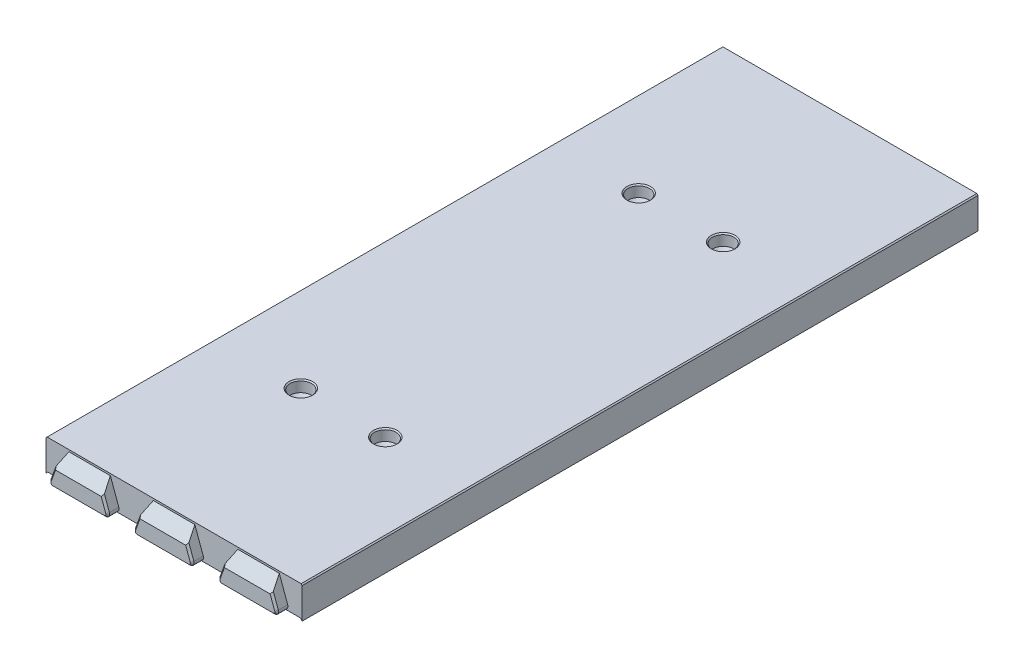
from build123d import *

# Parameters (mm, degrees)
BOSS_EXTRUDE1_DEPTH             = 90
SKETCH7_W                       = 64.25
SKETCH7_H                       = 6
BOSS_EXTRUDE7_DEPTH             = 1
BOSS_EXTRUDE4_DEPTH             = 3
BOSS_EXTRUDE8_REACH             = 98.584
BOSS_EXTRUDE8_DIRECTION_2_DEPTH = 2
CHAMFER4_SIZE                   = 0.5
FILLET4_R                       = 1
CHAMFER6_SIZE                   = 0.5
FILLET2_R                       = 2
CHAMFER4_OF_MIRROR2_SIZE        = 0.5
FILLET4_OF_MIRROR2_R            = 1
CHAMFER6_OF_MIRROR2_SIZE        = 0.5
FILLET2_OF_MIRROR2_R            = 2
BOSS_EXTRUDE9_REACH             = 188.326
SKETCH9_R                       = 5
FILLET3_R                       = 3
SKETCH10_R                      = 1.85
CUT_EXTRUDE2_DEPTH              = 187.326368571
SKETCH11_R                      = 2.85
CUT_EXTRUDE3_DEPTH              = 3
CHAMFER7_SIZE                   = 1
CUT_EXTRUDE4_DEPTH              = 187.326368571
CUT_EXTRUDE4_DEPTH_BACK         = 187.326368571
BOSS_EXTRUDE10_DEPTH            = 180
CHAMFER8_SIZE                   = 0.3


with BuildPart() as part:
    # Sketch1 → Boss-Extrude1 (new body)
    with BuildSketch(Plane.XY):
        Polygon((-34.125, 0), (-34.125, 8), (34.125, 8), (34.125, 0), (32.125, 0), (32.125, 6), (-32.125, 6), (-32.125, 0), align=None)
    boss_extrude1 = extrude(amount=-BOSS_EXTRUDE1_DEPTH)

    # Sketch7 → Boss-Extrude7 (add)
    with BuildSketch(Plane.XY):
        with Locations((0, 3)):
            Rectangle(SKETCH7_W, SKETCH7_H)
    boss_extrude7 = extrude(amount=-BOSS_EXTRUDE7_DEPTH)

    # Sketch2 → Boss-Extrude4 (add)
    with BuildSketch(Plane.XY):
        Polygon((17.161761874, 8), (14.25, 0), (30.75, 0), (27.838238126, 8), align=None)
        Polygon((-5.338238126, 8), (-8.25, 0), (8.25, 0), (5.338238126, 8), align=None)
        Polygon((-27.838238126, 8), (-30.75, 0), (-14.25, 0), (-17.161761874, 8), align=None)
    boss_extrude4 = extrude(amount=BOSS_EXTRUDE4_DEPTH)

    # Sketch8 → Boss-Extrude8 (add, up to next)
    with BuildSketch(Plane.XZ, mode=Mode.PRIVATE) as boss_extrude8_sk1:
        Polygon((-32.6, -24.741658736), (-32.6, -20.258341264), (-28.9, -21.605031131), (-28.9, -23.394968869), align=None)
    boss_extrude8_tool1 = extrude(boss_extrude8_sk1.sketch, amount=-BOSS_EXTRUDE8_REACH, mode=Mode.PRIVATE) - part.part
    # Sketch8 → Boss-Extrude8 (add, up to next)
    with BuildSketch(Plane.XZ, mode=Mode.PRIVATE) as boss_extrude8_sk2:
        Polygon((-32.6, -89.85), (-32.6, -87.758341264), (-28.9, -89.105031131), (-28.9, -89.85), (-28.9, -90), (-32.6, -90), align=None)
    boss_extrude8_tool2 = extrude(boss_extrude8_sk2.sketch, amount=-BOSS_EXTRUDE8_REACH, mode=Mode.PRIVATE) - part.part
    # Sketch8 → Boss-Extrude8 (add, up to next)
    with BuildSketch(Plane.XZ, mode=Mode.PRIVATE) as boss_extrude8_sk3:
        Polygon((32.6, -24.741658736), (28.9, -23.394968869), (28.9, -21.605031131), (32.6, -20.258341264), align=None)
    boss_extrude8_tool3 = extrude(boss_extrude8_sk3.sketch, amount=-BOSS_EXTRUDE8_REACH, mode=Mode.PRIVATE) - part.part
    # Sketch8 → Boss-Extrude8 (add, up to next)
    with BuildSketch(Plane.XZ, mode=Mode.PRIVATE) as boss_extrude8_sk4:
        Polygon((32.6, -89.85), (32.6, -90), (28.9, -90), (28.9, -89.85), (28.9, -89.105031131), (32.6, -87.758341264), align=None)
    boss_extrude8_tool4 = extrude(boss_extrude8_sk4.sketch, amount=-BOSS_EXTRUDE8_REACH, mode=Mode.PRIVATE) - part.part
    boss_extrude8_1 = boss_extrude8_tool1.solids().sort_by_distance((-31.014762, 0, -22.5))[0]
    add(boss_extrude8_1)
    boss_extrude8_2 = boss_extrude8_tool2.solids().sort_by_distance((-31.014762, 0, -89.16766))[0]
    add(boss_extrude8_2)
    boss_extrude8_3 = boss_extrude8_tool3.solids().sort_by_distance((31.014762, 0, -22.5))[0]
    add(boss_extrude8_3)
    boss_extrude8_4 = boss_extrude8_tool4.solids().sort_by_distance((31.014762, 0, -89.16766))[0]
    add(boss_extrude8_4)
    boss_extrude8 = boss_extrude8_1 + boss_extrude8_2 + boss_extrude8_3 + boss_extrude8_4  # Boss-Extrude8 as one shape, for the pattern or mirror that repeats it

    # Sketch8 → Boss-Extrude8 direction 2 (add)
    with BuildSketch(Plane.XZ):
        Polygon((-32.6, -24.741658736), (-32.6, -20.258341264), (-28.9, -21.605031131), (-28.9, -23.394968869), align=None)
        Polygon((-32.6, -89.85), (-32.6, -87.758341264), (-28.9, -89.105031131), (-28.9, -89.85), (-28.9, -90), (-32.6, -90), align=None)
        Polygon((32.6, -24.741658736), (28.9, -23.394968869), (28.9, -21.605031131), (32.6, -20.258341264), align=None)
        Polygon((32.6, -89.85), (32.6, -90), (28.9, -90), (28.9, -89.85), (28.9, -89.105031131), (32.6, -87.758341264), align=None)
    boss_extrude8_direction_2 = extrude(amount=BOSS_EXTRUDE8_DIRECTION_2_DEPTH)

    # Chamfer4
    chamfer4_edges = [part.edges().sort_by_distance(p)[0] for p in [
        (-32.6, -2, -88.879170632),
        (-28.9, -2, -89.552515565),
        (-30.75, -2, -88.431686197),
        (30.75, -2, -88.431686197),
        (28.9, -2, -89.552515565),
        (32.6, -2, -88.879170632),
        (32.6, -2, -22.5),
        (30.75, -2, -20.931686197),
        (28.9, -2, -22.5),
        (30.75, -2, -24.068313803),
        (-30.75, -2, -24.068313803),
        (-28.9, -2, -22.5),
        (-30.75, -2, -20.931686197),
        (-32.6, -2, -22.5),
    ]]
    chamfer(chamfer4_edges, length=CHAMFER4_SIZE)

    # Fillet4
    fillet4_edges = [part.edges().sort_by_distance(p)[0] for p in [
        (14.25, 0, 1.5),
        (30.75, 0, 1.5),
        (-8.25, 0, 1.5),
        (8.25, 0, 1.5),
        (-30.75, 0, 1.5),
        (-14.25, 0, 1.5),
    ]]
    fillet(fillet4_edges, radius=FILLET4_R)

    # Chamfer6
    chamfer6_edges = [part.edges().sort_by_distance(p)[0] for p in [
        (29.04989137, 4.671010072, 3),
        (22.5, 0, 3),
        (0, 0, 3),
        (-22.5, 0, 3),
        (14.858995962, 0.426423564, 3),
        (30.141004038, 0.426423564, 3),
        (6.54989137, 4.671010072, 3),
        (-7.641004038, 0.426423564, 3),
        (7.641004038, 0.426423564, 3),
        (-15.95010863, 4.671010072, 3),
        (-30.141004038, 0.426423564, 3),
        (-14.858995962, 0.426423564, 3),
        (15.95010863, 4.671010072, 3),
        (-6.54989137, 4.671010072, 3),
        (-29.04989137, 4.671010072, 3),
    ]]
    chamfer(chamfer6_edges, length=CHAMFER6_SIZE)

    # Fillet2
    fillet2_edges = [part.edges().sort_by_distance(p)[0] for p in [
        (-32.125, 6, -56.25),
        (-32.125, 3, -87.931227125),
        (-28.9, 6, -89.552515565),
        (-30.5125, 6, -88.518129128),
        (32.125, 6, -56.25),
        (32.125, 3, -87.931227125),
        (30.5125, 6, -88.518129128),
        (28.9, 6, -89.552515565),
        (32.125, 6, -10.715613563),
        (32.125, 3, -20.431227125),
        (32.125, 3, -24.568772875),
        (30.5125, 6, -21.018129128),
        (30.5125, 6, -23.981870872),
        (28.9, 6, -22.5),
        (-32.125, 3, -1),
        (0, 6, -1),
        (32.125, 3, -1),
        (-32.125, 6, -10.715613563),
        (-32.125, 3, -24.568772875),
        (-32.125, 3, -20.431227125),
        (-30.5125, 6, -23.981870872),
        (-30.5125, 6, -21.018129128),
        (-28.9, 6, -22.5),
    ]]
    fillet(fillet2_edges, radius=FILLET2_R)


with BuildPart() as mirror2_1:
    # Mirror2: Boss-Extrude1, Boss-Extrude7, Boss-Extrude4, Boss-Extrude8, Boss-Extrude8 direction 2 across plane
    add(boss_extrude1.mirror(Plane.XY.offset(-90)))
    add(boss_extrude7.mirror(Plane.XY.offset(-90)))
    add(boss_extrude4.mirror(Plane.XY.offset(-90)))
    add(boss_extrude8.mirror(Plane.XY.offset(-90)))
    add(boss_extrude8_direction_2.mirror(Plane.XY.offset(-90)))

    # Chamfer4 of Mirror2
    chamfer4_of_mirror2_edges = [mirror2_1.edges().sort_by_distance(p)[0] for p in [
        (-32.6, -2, -91.120829368),
        (-28.9, -2, -90.447484435),
        (-30.75, -2, -91.568313803),
        (30.75, -2, -91.568313803),
        (28.9, -2, -90.447484435),
        (32.6, -2, -91.120829368),
        (32.6, -2, -157.5),
        (30.75, -2, -159.068313803),
        (28.9, -2, -157.5),
        (30.75, -2, -155.931686197),
        (-30.75, -2, -155.931686197),
        (-28.9, -2, -157.5),
        (-30.75, -2, -159.068313803),
        (-32.6, -2, -157.5),
    ]]
    chamfer(chamfer4_of_mirror2_edges, length=CHAMFER4_OF_MIRROR2_SIZE)

    # Fillet4 of Mirror2
    fillet4_of_mirror2_edges = [mirror2_1.edges().sort_by_distance(p)[0] for p in [
        (14.25, 0, -181.5),
        (30.75, 0, -181.5),
        (-8.25, 0, -181.5),
        (8.25, 0, -181.5),
        (-30.75, 0, -181.5),
        (-14.25, 0, -181.5),
    ]]
    fillet(fillet4_of_mirror2_edges, radius=FILLET4_OF_MIRROR2_R)

    # Chamfer6 of Mirror2
    chamfer6_of_mirror2_edges = [mirror2_1.edges().sort_by_distance(p)[0] for p in [
        (29.04989137, 4.671010072, -183),
        (22.5, 0, -183),
        (0, 0, -183),
        (-22.5, 0, -183),
        (14.858995962, 0.426423564, -183),
        (30.141004038, 0.426423564, -183),
        (6.54989137, 4.671010072, -183),
        (-7.641004038, 0.426423564, -183),
        (7.641004038, 0.426423564, -183),
        (-15.95010863, 4.671010072, -183),
        (-30.141004038, 0.426423564, -183),
        (-14.858995962, 0.426423564, -183),
        (15.95010863, 4.671010072, -183),
        (-6.54989137, 4.671010072, -183),
        (-29.04989137, 4.671010072, -183),
    ]]
    chamfer(chamfer6_of_mirror2_edges, length=CHAMFER6_OF_MIRROR2_SIZE)

    # Fillet2 of Mirror2
    fillet2_of_mirror2_edges = [mirror2_1.edges().sort_by_distance(p)[0] for p in [
        (-32.125, 6, -123.75),
        (-32.125, 3, -92.068772875),
        (-28.9, 6, -90.447484435),
        (-30.5125, 6, -91.481870872),
        (32.125, 6, -123.75),
        (32.125, 3, -92.068772875),
        (30.5125, 6, -91.481870872),
        (28.9, 6, -90.447484435),
        (32.125, 6, -169.284386437),
        (32.125, 3, -159.568772875),
        (32.125, 3, -155.431227125),
        (30.5125, 6, -158.981870872),
        (30.5125, 6, -156.018129128),
        (28.9, 6, -157.5),
        (-32.125, 3, -179),
        (0, 6, -179),
        (32.125, 3, -179),
        (-32.125, 6, -169.284386437),
        (-32.125, 3, -155.431227125),
        (-32.125, 3, -159.568772875),
        (-30.5125, 6, -156.018129128),
        (-30.5125, 6, -158.981870872),
        (-28.9, 6, -157.5),
    ]]
    fillet(fillet2_of_mirror2_edges, radius=FILLET2_OF_MIRROR2_R)


with BuildPart() as part_1:
    add(part.part)

    # Mirror2 united with what the copies touc: union Mirror2_1
    add(mirror2_1.part)

    # Sketch9 → Boss-Extrude9 (add, up to next)
    with BuildSketch(Plane(origin=(0, 0, 0), x_dir=(1, 0, 0), z_dir=(0, 1, 0)), mode=Mode.PRIVATE) as boss_extrude9_sk1:
        with Locations(Location((-11.25, 45, 0), (0, 0, 90))):
            Circle(SKETCH9_R)
    boss_extrude9_tool1 = extrude(boss_extrude9_sk1.sketch, amount=BOSS_EXTRUDE9_REACH, mode=Mode.PRIVATE) - part_1.part
    # Sketch9 → Boss-Extrude9 (add, up to next)
    with BuildSketch(Plane(origin=(0, 0, 0), x_dir=(1, 0, 0), z_dir=(0, 1, 0)), mode=Mode.PRIVATE) as boss_extrude9_sk2:
        with Locations(Location((11.25, 45, 0), (0, 0, 90))):
            Circle(SKETCH9_R)
    boss_extrude9_tool2 = extrude(boss_extrude9_sk2.sketch, amount=BOSS_EXTRUDE9_REACH, mode=Mode.PRIVATE) - part_1.part
    # Sketch9 → Boss-Extrude9 (add, up to next)
    with BuildSketch(Plane(origin=(0, 0, 0), x_dir=(1, 0, 0), z_dir=(0, 1, 0)), mode=Mode.PRIVATE) as boss_extrude9_sk3:
        with Locations(Location((11.25, 135, 0), (0, 0, 90))):
            Circle(SKETCH9_R)
    boss_extrude9_tool3 = extrude(boss_extrude9_sk3.sketch, amount=BOSS_EXTRUDE9_REACH, mode=Mode.PRIVATE) - part_1.part
    # Sketch9 → Boss-Extrude9 (add, up to next)
    with BuildSketch(Plane(origin=(0, 0, 0), x_dir=(1, 0, 0), z_dir=(0, 1, 0)), mode=Mode.PRIVATE) as boss_extrude9_sk4:
        with Locations(Location((-11.25, 135, 0), (0, 0, 90))):
            Circle(SKETCH9_R)
    boss_extrude9_tool4 = extrude(boss_extrude9_sk4.sketch, amount=BOSS_EXTRUDE9_REACH, mode=Mode.PRIVATE) - part_1.part
    add(boss_extrude9_tool1.solids().sort_by_distance((-11.25, 0, -45))[0])
    add(boss_extrude9_tool2.solids().sort_by_distance((11.25, 0, -45))[0])
    add(boss_extrude9_tool3.solids().sort_by_distance((11.25, 0, -135))[0])
    add(boss_extrude9_tool4.solids().sort_by_distance((-11.25, 0, -135))[0])

    # Fillet3
    fillet3_edges = [part_1.edges().sort_by_distance(p)[0] for p in [
        (-11.25, 6, -40),
        (-11.25, 6, -130),
        (11.25, 6, -130),
        (11.25, 6, -40),
    ]]
    fillet(fillet3_edges, radius=FILLET3_R)

    # Sketch10 → Cut-Extrude2 (cut, through all)
    with BuildSketch(Plane(origin=(0, 0, 0), x_dir=(1, 0, 0), z_dir=(0, 1, 0))):
        with Locations(Location((-11.25, 45, 0), (0, 0, 270))):
            Circle(SKETCH10_R)
        with Locations(Location((11.25, 45, 0), (0, 0, 270))):
            Circle(SKETCH10_R)
        with Locations(Location((11.25, 135, 0), (0, 0, 270))):
            Circle(SKETCH10_R)
        with Locations(Location((-11.25, 135, 0), (0, 0, 270))):
            Circle(SKETCH10_R)
    extrude(amount=CUT_EXTRUDE2_DEPTH, mode=Mode.SUBTRACT)

    # Sketch11 → Cut-Extrude3 (cut)
    with BuildSketch(Plane(origin=(0, 8, 0), x_dir=(1, 0, 0), z_dir=(0, 1, 0))):
        with Locations(Location((-11.25, 135, 0), (0, 0, 270))):
            Circle(SKETCH11_R)
        with Locations(Location((11.25, 135, 0), (0, 0, 270))):
            Circle(SKETCH11_R)
        with Locations(Location((11.25, 45, 0), (0, 0, 270))):
            Circle(SKETCH11_R)
        with Locations(Location((-11.25, 45, 0), (0, 0, 270))):
            Circle(SKETCH11_R)
    extrude(amount=-CUT_EXTRUDE3_DEPTH, mode=Mode.SUBTRACT)

    # Chamfer7
    chamfer7_edges = [part_1.edges().sort_by_distance(p)[0] for p in [
        (-11.25, 5, -46.85),
        (11.25, 5, -46.85),
        (11.25, 5, -136.85),
        (-11.25, 5, -136.85),
    ]]
    chamfer(chamfer7_edges, length=CHAMFER7_SIZE - 0.0001)  # a hair under: the kernel refuses the full size

    # Sketch12 → Cut-Extrude4 (cut, two sides: drawn at the far end of the back side and taken through both)
    with BuildSketch(Plane(origin=(0, 0, 0), x_dir=(0, 0, -1), z_dir=(1, 0, 0)).offset(-CUT_EXTRUDE4_DEPTH_BACK)):
        Polygon((0, 7.5), (-3, 4.5), (-3, 7.5), (-3, 8), (0, 8), align=None)
        Polygon((183, 4.5), (183, 7.5), (183, 8), (180, 8), (180, 7.5), align=None)
    extrude(amount=CUT_EXTRUDE4_DEPTH + CUT_EXTRUDE4_DEPTH_BACK, mode=Mode.SUBTRACT)

    # Sketch13 → Boss-Extrude10 (add)
    with BuildSketch(Plane(origin=(0, 0, -180), x_dir=(-1, 0, 0), z_dir=(0, 0, -1))):
        Polygon((-33.625, 0), (-34.125, -0.5), (-34.125, 0), align=None)
        Polygon((34.125, 0), (33.625, 0), (34.125, -0.5), align=None)
    extrude(amount=-BOSS_EXTRUDE10_DEPTH)

    # Chamfer8
    chamfer8_edges = [part_1.edges().sort_by_distance(p)[0] for p in [
        (-34.125, 8, -90),
        (34.125, 8, -90),
        (-11.25, 8, -47.85),
        (11.25, 8, -47.85),
        (11.25, 8, -137.85),
        (-11.25, 8, -137.85),
    ]]
    chamfer(chamfer8_edges, length=CHAMFER8_SIZE)


solid = part_1.part
